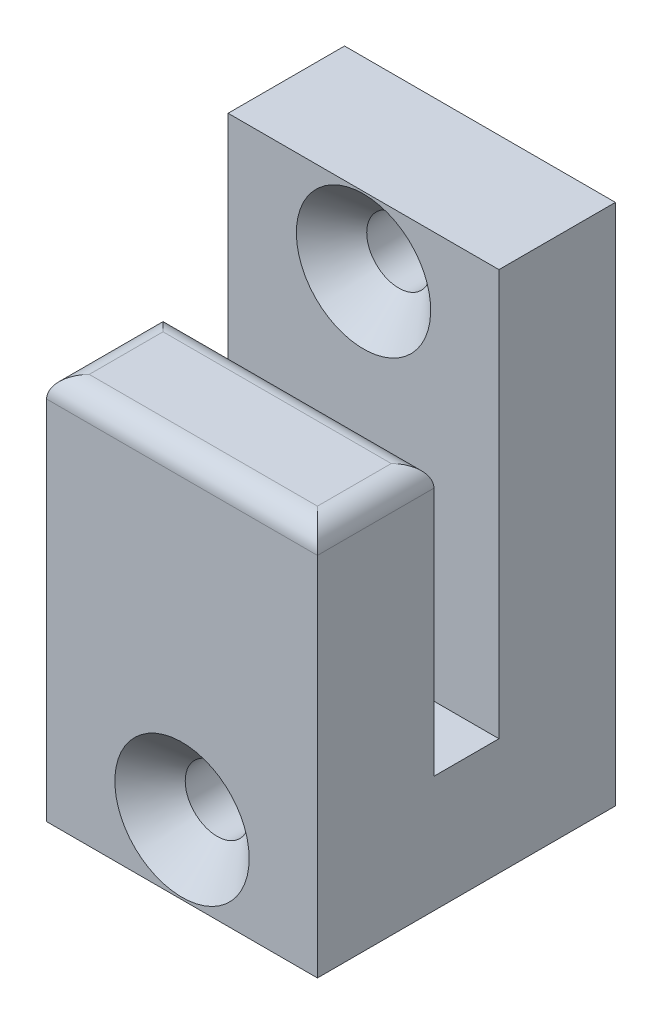
from build123d import *

# Parameters (mm, degrees)
BOSS_EXTRUDE1_DEPTH = 25.4
SKETCH2_R           = 3
CUT_EXTRUDE1_DEPTH  = 48.105483568
CHAMFER1_SIZE       = 3.3
FILLET1_R           = 2


with BuildPart() as part:
    # Sketch1 → Boss-Extrude1 (new body)
    with BuildSketch(Plane(origin=(0, 0, 0), x_dir=(0, 0, -1), z_dir=(1, 0, 0))):
        Polygon((-0.970833333, 15.458470238), (-11.892833333, 15.458470238), (-11.892833333, -20.863529762), (16.051166667, -20.863529762), (16.051166667, 28.158470238), (5.129166667, 28.158470238), (5.129166667, -9.941529762), (-0.970833333, -9.941529762), align=None)
    extrude(amount=BOSS_EXTRUDE1_DEPTH)

    # Sketch2 → Cut-Extrude1 (cut, through all)
    with BuildSketch(Plane(origin=(0, 0, -16.051166667), x_dir=(-1, 0, 0), z_dir=(0, 0, -1))):
        with Locations((-12.7, 21.658470238)):
            Circle(SKETCH2_R)
        with Locations((-12.7, -14.363529762)):
            Circle(SKETCH2_R)
    extrude(amount=-CUT_EXTRUDE1_DEPTH, mode=Mode.SUBTRACT)

    # Chamfer1
    chamfer1_edges = [part.edges().sort_by_distance(p)[0] for p in [
        (15.7, -14.363529762, 11.892833333),
        (15.7, 21.658470238, -5.129166667),
    ]]
    chamfer(chamfer1_edges, length=CHAMFER1_SIZE)

    # Fillet1
    fillet1_edges = [part.edges().sort_by_distance(p)[0] for p in [
        (12.7, 15.458470238, 0.970833333),
        (25.4, 15.458470238, 6.431833333),
        (12.7, 15.458470238, 11.892833333),
        (0, 15.458470238, 6.431833333),
    ]]
    fillet(fillet1_edges, radius=FILLET1_R)


solid = part.part
